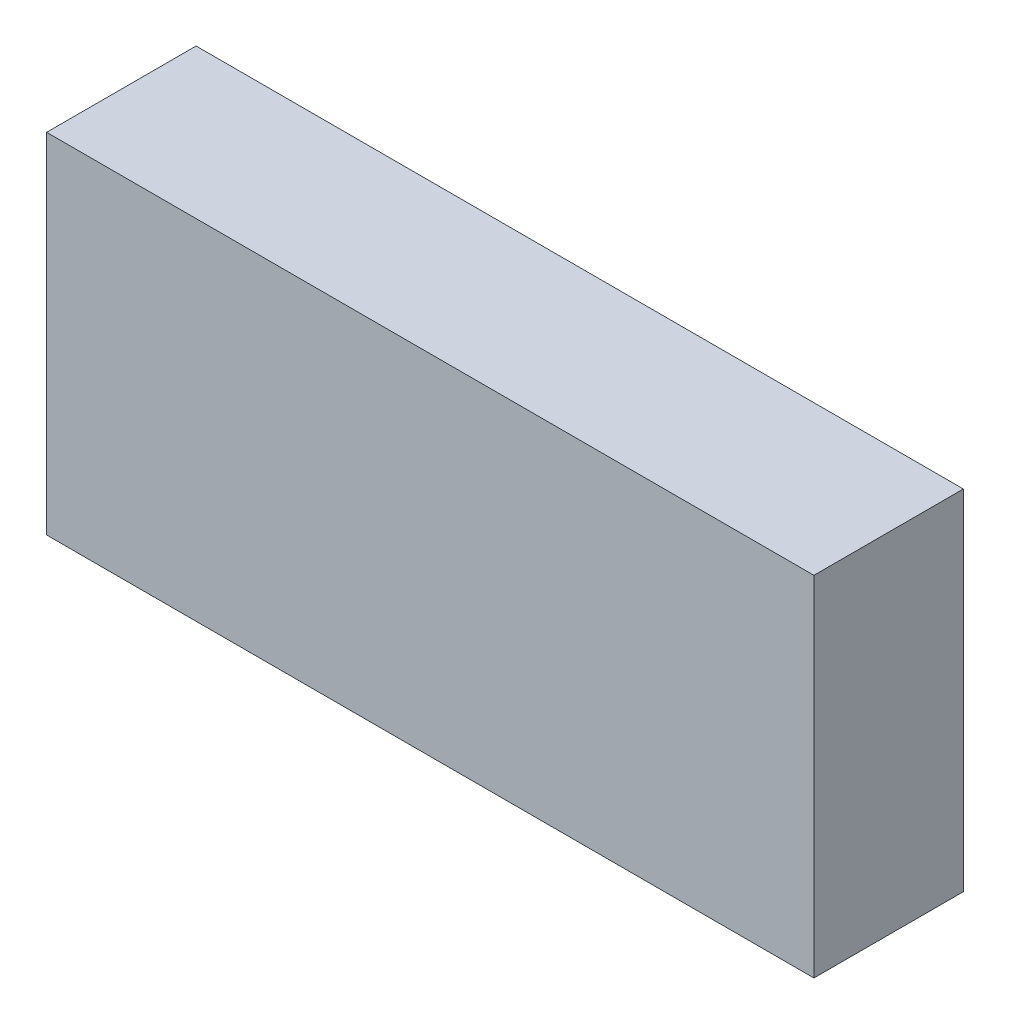
from build123d import *

# Parameters (mm, degrees)
SKETCH_1_W      = 77
SKETCH_1_H      = 35
EXTRUDE_1_DEPTH = 7.5


with BuildPart() as part:
    # Эскиз1 → Бобышка-Вытянуть1 (new, symmetric)
    with BuildSketch(Plane.XY):
        Rectangle(SKETCH_1_W, SKETCH_1_H)
    extrude(amount=EXTRUDE_1_DEPTH, both=True)


solid = part.part
